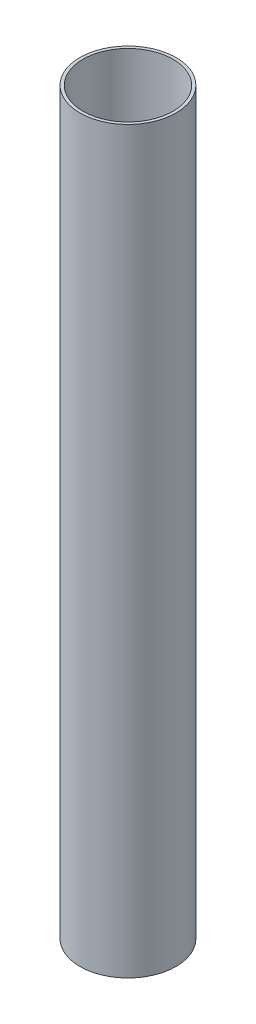
from build123d import *

# Parameters (mm, degrees)
SKETCH1_R           = 32.5
SKETCH1_R_2         = 30.5
BOSS_EXTRUDE1_DEPTH = 500


with BuildPart() as part:
    # Sketch1 → Boss-Extrude1 (new body)
    with BuildSketch(Plane(origin=(0, 0, 0), x_dir=(1, 0, 0), z_dir=(0, 1, 0))):
        Circle(SKETCH1_R)
        Circle(SKETCH1_R_2, mode=Mode.SUBTRACT)
    extrude(amount=BOSS_EXTRUDE1_DEPTH)


solid = part.part
